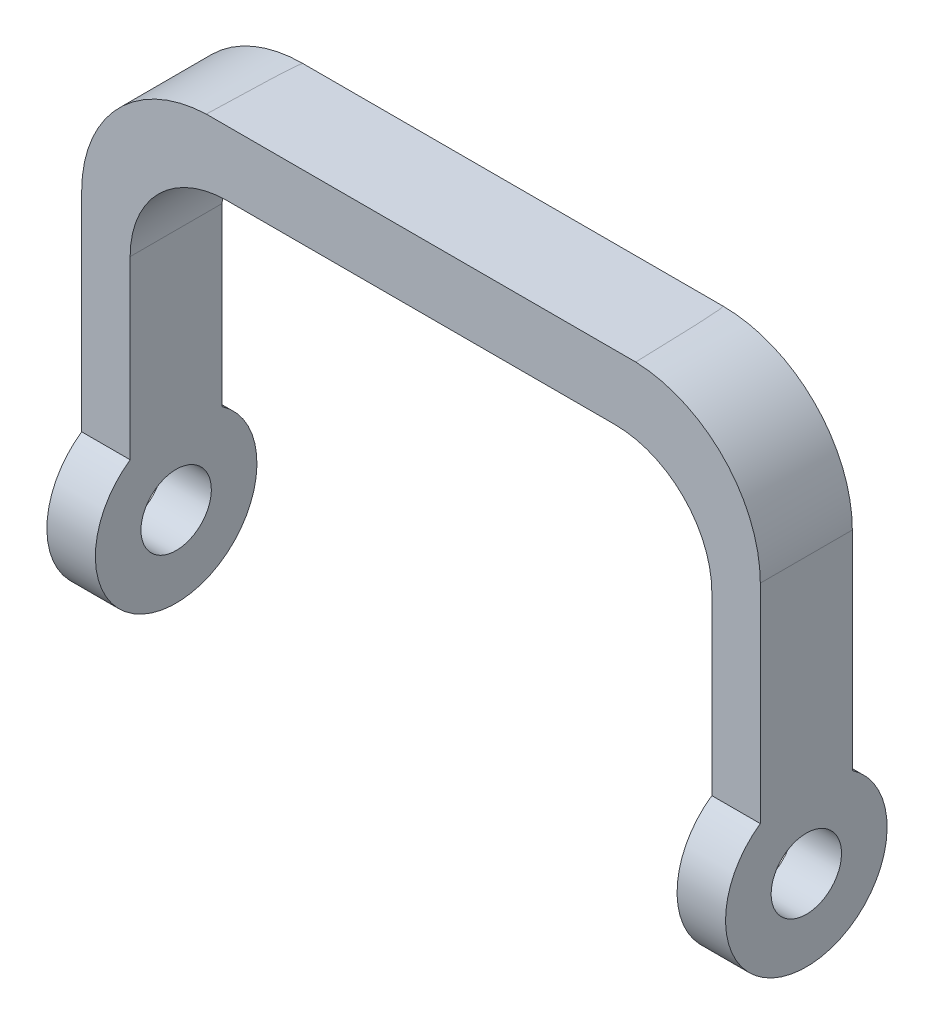
from build123d import *

# Parameters (mm, degrees)
EXTRUDE_1_DEPTH     = 100
CUT_EXTRUDE_1_DEPTH = 380.605057922
SKETCH_3_OUTSIDE_W  = 207.148
SKETCH_3_OUTSIDE_H  = 407.148
SKETCH_3_OUTSIDE_R  = 21.770153001
CUT_EXTRUDE_2_DEPTH = 526.737577124


with BuildPart() as part:
    # Эскиз1 → Бобышка-Вытянуть1 (new body)
    with BuildSketch(Plane.XY):
        with BuildLine():
            Line((-210, 0), (210, 0))
            Line((210, 0), (210, 220))
            ThreePointArc((210, 220), (186.568542495, 276.568542495), (130, 300))
            Line((130, 300), (-130, 300))
            ThreePointArc((-130, 300), (-186.568542495, 276.568542495), (-210, 220))
            Line((-210, 220), (-210, 0))
        make_face()
    extrude(amount=EXTRUDE_1_DEPTH)

    # Эскиз2 → Вырез-Вытянуть1 (cut, through all)
    with BuildSketch(Plane.XY.offset(100)):
        with BuildLine():
            Line((-180, 0), (180, 0))
            Line((180, 0), (180, 200))
            ThreePointArc((180, 200), (162.426406871, 242.426406871), (120, 260))
            Line((120, 260), (-120, 260))
            ThreePointArc((-120, 260), (-162.426406871, 242.426406871), (-180, 200))
            Line((-180, 200), (-180, 0))
        make_face()
    extrude(amount=-CUT_EXTRUDE_1_DEPTH, mode=Mode.SUBTRACT)

    # Эскиз3 outside → Вырез-Вытянуть2 (cut, through all)
    # profile 1 of 2: a face of its own
    with BuildSketch(Plane(origin=(210, 0, 0), x_dir=(0, 0, -1), z_dir=(1, 0, 0))):
        with Locations((-50, 150)):
            Rectangle(SKETCH_3_OUTSIDE_W, SKETCH_3_OUTSIDE_H)
        with BuildLine():
            Line((-78.46975089, 299.947886103), (-21.53024911, 300))
            Line((-21.53024911, 300), (-21.53024911, 91.103202847))
            ThreePointArc((-21.53024911, 91.103202847), (-50, 0), (-78.46975089, 91.103202847))
            Line((-78.46975089, 91.103202847), (-78.46975089, 299.947886103))
        make_face(mode=Mode.SUBTRACT)
    # profile 2 of 2: a face of its own
    with BuildSketch(Plane(origin=(210, 0, 0), x_dir=(0, 0, -1), z_dir=(1, 0, 0))):
        with Locations((-50, 50)):
            Circle(SKETCH_3_OUTSIDE_R)
    extrude(amount=-CUT_EXTRUDE_2_DEPTH, mode=Mode.SUBTRACT)


solid = part.part
